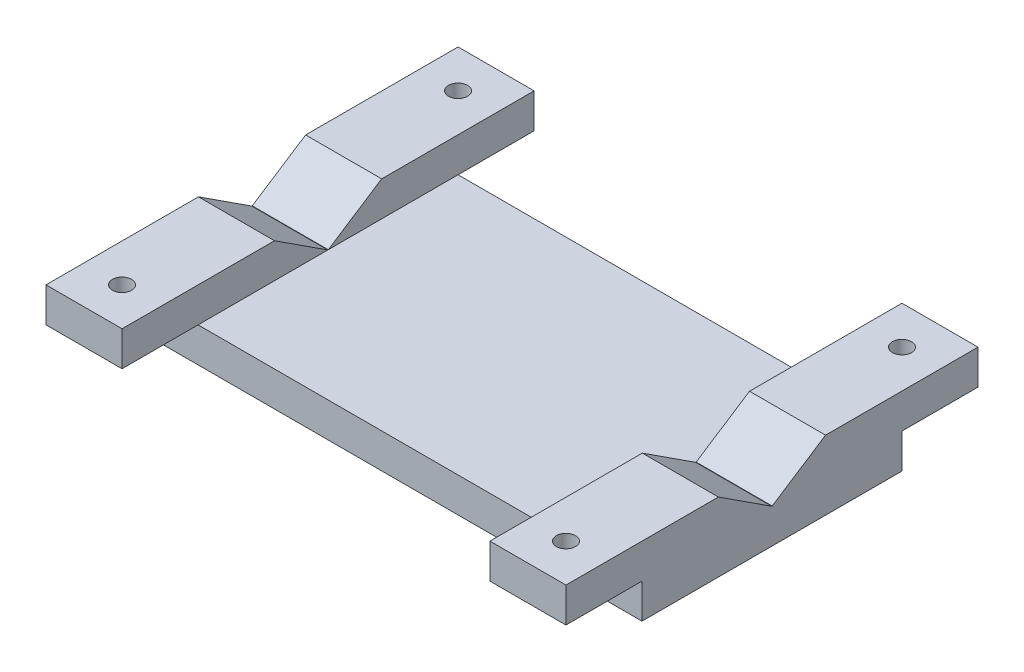
from build123d import *

# Parameters (mm, degrees)
SKETCH1_W           = 60
SKETCH1_H           = 30
BOSS_EXTRUDE1_DEPTH = 4
SKETCH2_W           = 8.7752
SKETCH2_H           = 17.5504
SKETCH2_R           = 1.1
BOSS_EXTRUDE2_DEPTH = 4
CHAMFER1_SIZE       = 6.2
CHAMFER1_SIZE_2     = 4.026327078


with BuildPart() as part:
    # Sketch1 → Boss-Extrude1 (new body)
    with BuildSketch(Plane(origin=(0, 0, 0), x_dir=(1, 0, 0), z_dir=(0, 1, 0))):
        Rectangle(SKETCH1_W, SKETCH1_H)
    extrude(amount=BOSS_EXTRUDE1_DEPTH)

    # Sketch2 → Boss-Extrude2 (add)
    # profile 1 of 4: a face of its own
    with BuildSketch(Plane(origin=(0, 4, 0), x_dir=(1, 0, 0), z_dir=(0, 1, 0))):
        with Locations((-25.6124, 15)):
            Rectangle(SKETCH2_W, SKETCH2_H)
        with Locations(Location((-25.6124, 19.3876, 0), (0, 0, 270))):
            Circle(SKETCH2_R, mode=Mode.SUBTRACT)
    # profile 2 of 4: a face of its own
    with BuildSketch(Plane(origin=(0, 4, 0), x_dir=(1, 0, 0), z_dir=(0, 1, 0))):
        with Locations((-25.6124, -15)):
            Rectangle(SKETCH2_W, SKETCH2_H)
        with Locations(Location((-25.6124, -19.3876, 0), (0, 0, 90))):
            Circle(SKETCH2_R, mode=Mode.SUBTRACT)
    # profile 3 of 4: a face of its own
    with BuildSketch(Plane(origin=(0, 4, 0), x_dir=(1, 0, 0), z_dir=(0, 1, 0))):
        with Locations((25.6124, -15)):
            Rectangle(SKETCH2_W, SKETCH2_H)
        with Locations(Location((25.6124, -19.3876, 0), (0, 0, 270))):
            Circle(SKETCH2_R, mode=Mode.SUBTRACT)
    # profile 4 of 4: a face of its own
    with BuildSketch(Plane(origin=(0, 4, 0), x_dir=(1, 0, 0), z_dir=(0, 1, 0))):
        with Locations((25.6124, 15)):
            Rectangle(SKETCH2_W, SKETCH2_H)
        with Locations(Location((25.6124, 19.3876, 0), (0, 0, 90))):
            Circle(SKETCH2_R, mode=Mode.SUBTRACT)
    extrude(amount=BOSS_EXTRUDE2_DEPTH)

    # Chamfer1
    # the kernel refuses this chamfer: 6.2, 4.026327078 mm, written as the material it adds along each edge
    with BuildSketch(Plane(origin=(30, 4, -6.2248), x_dir=(0, -0.021073765466273358, 0.9997779235455605), z_dir=(-1, 0, 0))) as chamfer1_piece_1_section:
        Polygon((CHAMFER1_SIZE * 0.999777923546, CHAMFER1_SIZE * 0.0210737654663), (-CHAMFER1_SIZE_2 * 0.0210737654654, CHAMFER1_SIZE_2 * 0.999777923502), (0, 0), align=None)
    chamfer1_piece_1 = extrude(amount=8.7752, mode=Mode.PRIVATE)
    chamfer1_piece_1 = split(chamfer1_piece_1, bisect_by=Plane(origin=(25.6124, 8, -4.147892519), z_dir=(0, -1, 0)), keep=Keep.TOP, mode=Mode.PRIVATE)
    add(chamfer1_piece_1)
    with BuildSketch(Plane(origin=(30, 4, 6.2248), x_dir=(0, -0.021073765466273358, -0.9997779235455605), z_dir=(-1, 0, 0))) as chamfer1_piece_2_section:
        Polygon((CHAMFER1_SIZE * 0.999777923546, -CHAMFER1_SIZE * 0.0210737654663), (-CHAMFER1_SIZE_2 * 0.0210737654654, -CHAMFER1_SIZE_2 * 0.999777923502), (0, 0), align=None)
    chamfer1_piece_2 = extrude(amount=8.7752, mode=Mode.PRIVATE)
    chamfer1_piece_2 = split(chamfer1_piece_2, bisect_by=Plane(origin=(25.6124, 8, 4.147892519), z_dir=(0, -1, 0)), keep=Keep.TOP, mode=Mode.PRIVATE)
    add(chamfer1_piece_2)
    with BuildSketch(Plane(origin=(-30, 4, 6.2248), x_dir=(0, -0.021073765466273358, -0.9997779235455605), z_dir=(1, 0, 0))) as chamfer1_piece_3_section:
        Polygon((CHAMFER1_SIZE * 0.999777923546, CHAMFER1_SIZE * 0.0210737654663), (-CHAMFER1_SIZE_2 * 0.0210737654654, CHAMFER1_SIZE_2 * 0.999777923502), (0, 0), align=None)
    chamfer1_piece_3 = extrude(amount=8.7752, mode=Mode.PRIVATE)
    chamfer1_piece_3 = split(chamfer1_piece_3, bisect_by=Plane(origin=(-25.6124, 8, 4.147892519), z_dir=(0, -1, 0)), keep=Keep.TOP, mode=Mode.PRIVATE)
    add(chamfer1_piece_3)
    with BuildSketch(Plane(origin=(-30, 4, -6.2248), x_dir=(0, -0.021073765466273358, 0.9997779235455605), z_dir=(1, 0, 0))) as chamfer1_piece_4_section:
        Polygon((CHAMFER1_SIZE * 0.999777923546, -CHAMFER1_SIZE * 0.0210737654663), (-CHAMFER1_SIZE_2 * 0.0210737654654, -CHAMFER1_SIZE_2 * 0.999777923502), (0, 0), align=None)
    chamfer1_piece_4 = extrude(amount=8.7752, mode=Mode.PRIVATE)
    chamfer1_piece_4 = split(chamfer1_piece_4, bisect_by=Plane(origin=(-25.6124, 8, -4.147892519), z_dir=(0, -1, 0)), keep=Keep.TOP, mode=Mode.PRIVATE)
    add(chamfer1_piece_4)


solid = part.part
